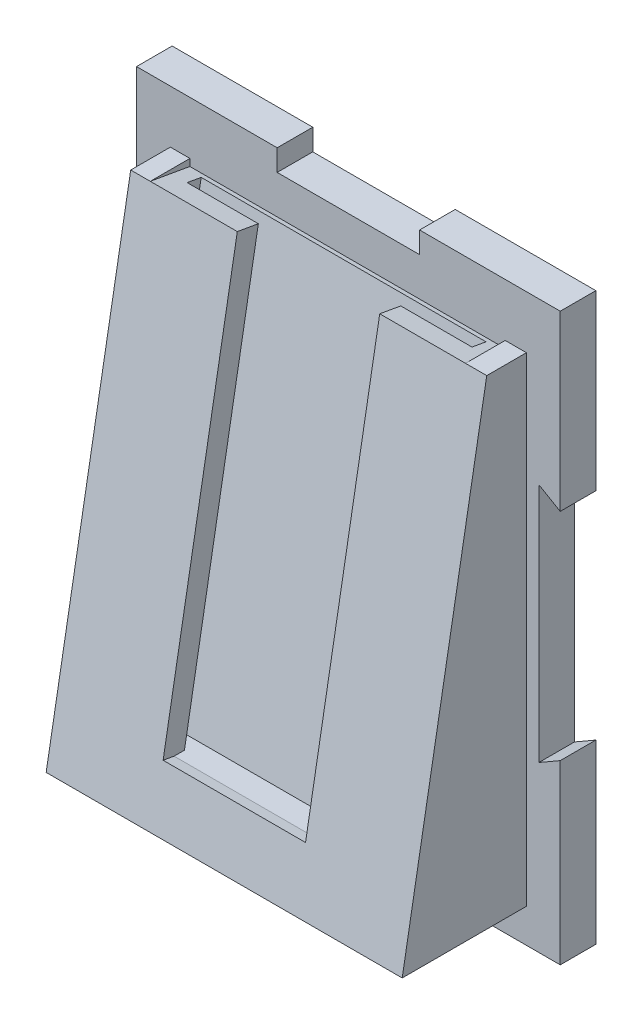
from build123d import *

# Parameters (mm, degrees)
BOSS_EXTRUDE1_DEPTH = 5
SKETCH8_W           = 50
SKETCH8_H           = 70
CUT_EXTRUDE2_DEPTH  = 50
BOSS_EXTRUDE2_START = -30
SKETCH6_W           = 3
SKETCH6_H           = 2
SKETCH6_H_2         = 3
SKETCH6_W_2         = 10
BOSS_EXTRUDE2_DEPTH = 60
BOSS_EXTRUDE3_START = -30
SKETCH7_W           = 46
SKETCH7_H           = 5
BOSS_EXTRUDE3_DEPTH = 3
SKETCH11_W          = 46
SKETCH11_H          = 63
BOSS_EXTRUDE4_DEPTH = 5
BOSS_EXTRUDE6_REACH = 56.109
SKETCH13_W          = 51.830863245
SKETCH13_H          = 5.290230228
BOSS_EXTRUDE7_DEPTH = 5
BOSS_EXTRUDE8_START = 5.021523682
BOSS_EXTRUDE8_DEPTH = 1.000000021


# Read off the part's stored shape, not the designer's step: Boss-Extrude8
with BuildPart() as part:
    # Sketch4 → Boss-Extrude1 (new body)
    with BuildSketch(Plane(origin=(0, 0, 0), x_dir=(0, 1, 0), z_dir=(0, 0, 1))):
        Polygon((-39.75, -29.75), (-14.905444566, -29.75), (-16.637495374, -26.75), (0.24999995, -26.75), (17.137495374, -26.75), (15.405444566, -29.75), (39.75, -29.75), (39.75, -10), (36.75, -10), (36.75, 10), (39.75, 10), (39.75, 29.75), (15.405444566, 29.75), (17.137495374, 26.75), (0.250000065, 26.75), (-16.637495374, 26.75), (-14.905444566, 29.75), (-39.75, 29.75), (-39.75, 10), (-36.75, 10), (-36.75, -10), (-39.75, -10), align=None)
    extrude(amount=BOSS_EXTRUDE1_DEPTH)

    # Sketch8 → Cut-Extrude2 (cut)
    with BuildSketch(Plane(origin=(0, 0, 0), x_dir=(1, 0, 0), z_dir=(0, 0, -1))):
        Rectangle(SKETCH8_W, SKETCH8_H)
    extrude(amount=-CUT_EXTRUDE2_DEPTH, mode=Mode.SUBTRACT)



with BuildPart() as body_2:
    # Sketch6 → Boss-Extrude2 (new body)
    with BuildSketch(Plane(origin=(0, -0.558315077, -3.166362145), x_dir=(1, 0, 0), z_dir=(0, -0.9848077530122069, 0.1736481776669375)).offset(BOSS_EXTRUDE2_START)):
        with Locations((-21.528635138, 15.236732087)):
            Rectangle(SKETCH6_W, SKETCH6_H)
        with Locations((-21.528635138, 17.736732087)):
            Rectangle(SKETCH6_W, SKETCH6_H_2)
        with Locations((-15.028635138, 17.736732087)):
            Rectangle(SKETCH6_W_2, SKETCH6_H_2)
        with Locations((21.471364862, 15.236732087)):
            Rectangle(SKETCH6_W, SKETCH6_H)
        with Locations((21.471364862, 17.736732087)):
            Rectangle(SKETCH6_W, SKETCH6_H_2)
        with Locations((14.971364862, 17.736732087)):
            Rectangle(SKETCH6_W_2, SKETCH6_H_2)
    extrude(amount=BOSS_EXTRUDE2_DEPTH)



with BuildPart() as body_3:
    # Sketch7 → Boss-Extrude3 (new body)
    with BuildSketch(Plane(origin=(0, 0, 0), x_dir=(-1, 0, 0), z_dir=(0, 0.9848077530122069, -0.1736481776669375)).offset(BOSS_EXTRUDE3_START)):
        with Locations((0.028635138, 13.521523703)):
            Rectangle(SKETCH7_W, SKETCH7_H)
    extrude(amount=-BOSS_EXTRUDE3_DEPTH)


with BuildPart() as body_2_1:
    add(body_2.part)

    add(body_3.part)  # Boss-Extrude4 merges body 3
    # Sketch11 → Boss-Extrude4 (add)
    with BuildSketch(Plane(origin=(0, 1.913867506, 10.854081993), x_dir=(1, 0, 0), z_dir=(0, -0.17364817766693746, -0.9848077530122068))):
        with Locations((-0.028635138, 1.5)):
            Rectangle(SKETCH11_W, SKETCH11_H)
    extrude(amount=BOSS_EXTRUDE4_DEPTH)


with BuildPart() as part_1:
    add(part.part)

    add(body_2_1.part)  # Boss-Extrude6 merges body 2
    # Boss-Extrude6: up to this plane
    boss_extrude6_end = Plane(origin=(22.971364862, 32.326340985, 10.568675428), z_dir=(0, 0.17364817766693744, 0.9848077530122069))
    # Sketch12 → Boss-Extrude6 (add, up to the surface)
    with BuildSketch(Plane(origin=(0, 0, 0), x_dir=(1, 0, 0), z_dir=(0, 0, -1)), mode=Mode.PRIVATE) as boss_extrude6_sk1:
        Polygon((-25, -32.326340985), (-22.25188492, -32.326340985), (-22.25188492, 27.03466657), (22.017654552, 27.03466657), (22.017654552, -32.326340985), (25, -32.326340985), (25, 35), (-25, 35), align=None)
    boss_extrude6_tool1 = split(extrude(boss_extrude6_sk1.sketch, amount=-BOSS_EXTRUDE6_REACH, mode=Mode.PRIVATE), bisect_by=boss_extrude6_end, keep=Keep.BOTH, mode=Mode.PRIVATE)
    add(boss_extrude6_tool1.solids().sort_by_distance((-23.625942, 31.487721, 0))[0])

    # Sketch13 → Boss-Extrude7 (add)
    with BuildSketch(Plane(origin=(0, 0, 0), x_dir=(1, 0, 0), z_dir=(0, 0, -1))):
        with Locations((-0.078348401, -32.848959795)):
            Rectangle(SKETCH13_W, SKETCH13_H)
    extrude(amount=-BOSS_EXTRUDE7_DEPTH)

    # Boss-Extrude8 outline → Boss-Extrude8 (add)
    # profile 1 of 3: a face of its own
    with BuildSketch(Plane(origin=(0, 0, 0), x_dir=(1, 0, 0), z_dir=(0, 0.1736481776669375, 0.9848077530122069)).offset(BOSS_EXTRUDE8_START)):
        with BuildLine():
            add(Edge.make_bspline(
                [(-10.467851841, 5.945152171), (-10.986974105, 5.93651447), (-11.500854153, 5.896229421), (-12.498790484, 5.635612757), (-12.985546819, 5.414483257), (-13.797961559, 4.74423563), (-14.118849525, 4.313672985), (-14.500878838, 3.342927953), (-14.563491586, 2.813042118), (-14.576316895, 2.28783257)],
                knots=[0, 0, 0, 0, 0.25, 0.25, 0.5, 0.5, 0.75, 0.75, 1, 1, 1, 1], degree=3))
            add(Edge.make_bspline(
                [(-14.576316895, 2.28783257), (-14.564248114, 1.730329849), (-14.485127057, 1.171617147), (-14.041607684, 0.154100247), (-13.697450783, -0.299455445), (-12.861318405, -1.029274155), (-12.357191638, -1.292181087), (-11.287857522, -1.614507239), (-10.731412411, -1.666616468), (-10.173846939, -1.678699083)],
                knots=[0, 0, 0, 0, 0.25, 0.25, 0.5, 0.5, 0.75, 0.75, 1, 1, 1, 1], degree=3))
            Line((-10.173846939, -1.678699083), (-8.574561652, -1.678699083))
            Line((-8.574561652, -1.678699083), (-8.574561652, -6.382777516))
            Line((-8.574561652, -6.382777516), (-7.114675242, -6.382777516))
            Line((-7.114675242, -6.382777516), (-7.114675242, 5.945152171))
            Line((-7.114675242, 5.945152171), (-10.467851841, 5.945152171))
        make_face()
        with BuildLine():
            Line((-8.574561652, -0.381022274), (-10.075000463, -0.381022274))
            add(Edge.make_bspline(
                [(-10.075000463, -0.381022274), (-10.454019642, -0.376067015), (-10.82957333, -0.347620207), (-11.563501324, -0.174272567), (-11.922431464, -0.026106182), (-12.530252018, 0.44277106), (-12.769732325, 0.751236277), (-13.058396455, 1.452245522), (-13.106849265, 1.837560064), (-13.116430485, 2.219400395)],
                knots=[0, 0, 0, 0, 0.25, 0.25, 0.5, 0.5, 0.75, 0.75, 1, 1, 1, 1], degree=3))
            add(Edge.make_bspline(
                [(-13.116430485, 2.219400395), (-13.111547413, 2.5782319), (-13.069607652, 2.936381873), (-12.8109443, 3.606784644), (-12.593110897, 3.90761083), (-11.721692221, 4.542687822), (-10.970699083, 4.634581597), (-10.252417214, 4.647475362)],
                knots=[0, 0, 0, 0, 0.25, 0.25, 0.5, 0.5, 1, 1, 1, 1], degree=3))
            Line((-10.252417214, 4.647475362), (-8.574561652, 4.647475362))
            Line((-8.574561652, 4.647475362), (-8.574561652, -0.381022274))
        make_face(mode=Mode.SUBTRACT)
    # profile 2 of 3: a face of its own
    with BuildSketch(Plane(origin=(0, 0, 0), x_dir=(1, 0, 0), z_dir=(0, 0.1736481776669375, 0.9848077530122069)).offset(BOSS_EXTRUDE8_START)):
        Polygon((14.783620913, 4.647475362), (14.783620913, 5.945152171), (6.186512052, 5.945152171), (6.186512052, 4.647475362), (9.755123278, 4.647475362), (9.755123278, -6.382777516), (11.215009688, -6.382777516), (11.215009688, 4.647475362), align=None)
    # profile 3 of 3: a face of its own
    with BuildSketch(Plane(origin=(0, 0, 0), x_dir=(1, 0, 0), z_dir=(0, 0.1736481776669375, 0.9848077530122069)).offset(BOSS_EXTRUDE8_START)):
        Polygon((5.699883249, -6.382777516), (0.945114315, 5.945152171), (-0.55785902, 5.945152171), (-5.330369629, -6.382777516), (-3.723480768, -6.382777516), (-2.423269434, -2.976375892), (2.868818804, -2.976375892), (4.082856287, -6.382777516), align=None)
        with BuildLine():
            Line((0.202498485, 4.485265761), (0.23544731, 4.485265761))
            add(Edge.make_bspline(
                [(0.23544731, 4.485265761), (0.247945589, 4.41509498), (0.260444435, 4.344921063), (0.273754544, 4.274899734), (0.287066266, 4.20486992), (0.301165705, 4.134968363), (0.317053985, 4.065477793), (0.34874631, 3.92686507), (0.391135692, 3.790647481), (0.438209312, 3.65647608)],
                knots=[0, 0, 0, 0, 0.250067921, 0.250067921, 0.250067921, 0.500190861, 0.500190861, 0.500190861, 1, 1, 1, 1], degree=3))
            Line((0.438209312, 3.65647608), (2.389793575, -1.678699083))
            Line((2.389793575, -1.678699083), (-1.94677873, -1.678699083))
            Line((-1.94677873, -1.678699083), (0.014943634, 3.65647608))
            add(Edge.make_bspline(
                [(0.014943634, 3.65647608), (0.036185093, 3.724160229), (0.057270848, 3.791932402), (0.075717575, 3.860431029), (0.094170953, 3.928954356), (0.110345138, 3.998113348), (0.124780214, 4.067594296), (0.153586161, 4.206247155), (0.177650794, 4.345849154), (0.202498485, 4.485265761)],
                knots=[0, 0, 0, 0, 0.250210129, 0.250210129, 0.250210129, 0.500538862, 0.500538862, 0.500538862, 1, 1, 1, 1], degree=3))
        make_face(mode=Mode.SUBTRACT)
    extrude(amount=BOSS_EXTRUDE8_DEPTH)


solid = part_1.part
